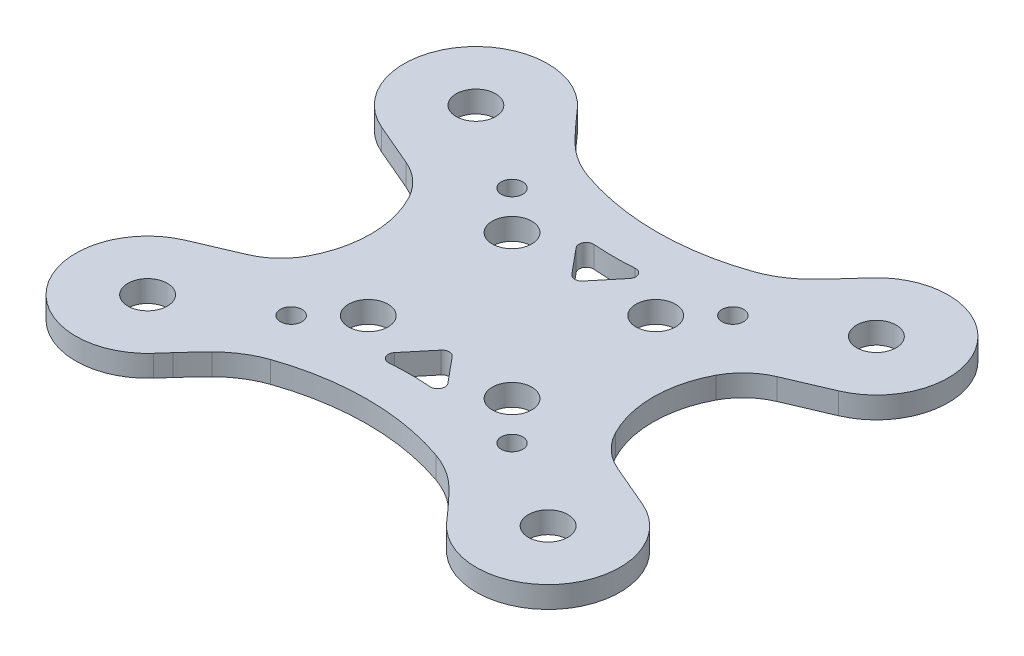
from build123d import *

# Parameters (mm, degrees)
SKETCH2_R           = 1.5
SKETCH2_R_2         = 2.75
BOSS_EXTRUDE1_DEPTH = 3


with BuildPart() as part:
    # Sketch2 → Boss-Extrude1 (new body)
    with BuildSketch(Plane(origin=(0, 0, 0), x_dir=(1, 0, 0), z_dir=(0, 1, 0))):
        with BuildLine():
            Line((-20.402989885, -29.497935256), (-19.112268572, -28.051458372))
            ThreePointArc((-19.112268572, -28.051458372), (-17.810696545, -26.629075982), (-16.473919979, -25.239727278))
            ThreePointArc((-16.473919979, -25.239727278), (-14.160863056, -23.377992793), (-11.485697638, -22.089669229))
            ThreePointArc((-11.485697638, -22.089669229), (0, -20.15141071), (11.485697638, -22.089669229))
            ThreePointArc((11.485697638, -22.089669229), (14.160863056, -23.377992793), (16.473919979, -25.239727278))
            ThreePointArc((16.473919979, -25.239727278), (17.810696545, -26.629075982), (19.112268572, -28.051458372))
            Line((19.112268572, -28.051458372), (20.402989885, -29.497935256))
            ThreePointArc((20.402989885, -29.497935256), (35.984508278, -28.676365345), (31.796806607, -13.645668513))
            Line((31.796806607, -13.645668513), (25.794436634, -11.078432427))
            ThreePointArc((25.794436634, -11.078432427), (23.235962273, -9.423067761), (21.376539879, -7.008824278))
            ThreePointArc((21.376539879, -7.008824278), (19.638379202, 0), (21.376539879, 7.008824278))
            ThreePointArc((21.376539879, 7.008824278), (23.235962273, 9.423067761), (25.794436634, 11.078432427))
            Line((25.794436634, 11.078432427), (31.796806607, 13.645668513))
            ThreePointArc((31.796806607, 13.645668513), (35.984508278, 28.676365345), (20.402989885, 29.497935256))
            Line((20.402989885, 29.497935256), (19.112268572, 28.051458372))
            ThreePointArc((19.112268572, 28.051458372), (17.810696545, 26.629075982), (16.473919979, 25.239727278))
            ThreePointArc((16.473919979, 25.239727278), (14.160863056, 23.377992793), (11.485697638, 22.089669229))
            ThreePointArc((11.485697638, 22.089669229), (0, 20.15141071), (-11.485697638, 22.089669229))
            ThreePointArc((-11.485697638, 22.089669229), (-14.160863056, 23.377992793), (-16.473919979, 25.239727278))
            ThreePointArc((-16.473919979, 25.239727278), (-17.810696545, 26.629075982), (-19.112268572, 28.051458372))
            Line((-19.112268572, 28.051458372), (-20.402989885, 29.497935256))
            ThreePointArc((-20.402989885, 29.497935256), (-35.984508278, 28.676365345), (-31.796806607, 13.645668513))
            Line((-31.796806607, 13.645668513), (-25.794436634, 11.078432427))
            ThreePointArc((-25.794436634, 11.078432427), (-23.235962273, 9.423067761), (-21.376539879, 7.008824278))
            ThreePointArc((-21.376539879, 7.008824278), (-19.638379202, 0), (-21.376539879, -7.008824278))
            ThreePointArc((-21.376539879, -7.008824278), (-23.235962273, -9.423067761), (-25.794436634, -11.078432427))
            Line((-25.794436634, -11.078432427), (-31.796806607, -13.645668513))
            ThreePointArc((-31.796806607, -13.645668513), (-35.984508278, -28.676365345), (-20.402989885, -29.497935256))
        make_face()
        with Locations((15.365, -15.365)):
            Circle(SKETCH2_R, mode=Mode.SUBTRACT)
        with Locations((27.864354565, 22.840004863)):
            Circle(SKETCH2_R_2, mode=Mode.SUBTRACT)
        with Locations((-15.365, 15.365)):
            Circle(SKETCH2_R, mode=Mode.SUBTRACT)
        with Locations((15.365, 15.365)):
            Circle(SKETCH2_R, mode=Mode.SUBTRACT)
        with Locations((-15.365, -15.365)):
            Circle(SKETCH2_R, mode=Mode.SUBTRACT)
        with Locations((27.864354565, -22.840004863)):
            Circle(SKETCH2_R_2, mode=Mode.SUBTRACT)
        with Locations((10.000016395, -10.000011804)):
            Circle(SKETCH2_R_2, mode=Mode.SUBTRACT)
        with Locations((-27.864354565, 22.840004863)):
            Circle(SKETCH2_R_2, mode=Mode.SUBTRACT)
        with Locations((-27.864354565, -22.840004863)):
            Circle(SKETCH2_R_2, mode=Mode.SUBTRACT)
        with Locations((-10.000016395, -10.000011804)):
            Circle(SKETCH2_R_2, mode=Mode.SUBTRACT)
        with Locations((-10.000016395, 10.000011804)):
            Circle(SKETCH2_R_2, mode=Mode.SUBTRACT)
        with Locations((10.000016395, 10.000011804)):
            Circle(SKETCH2_R_2, mode=Mode.SUBTRACT)
        with BuildLine():
            Line((3.71054333, -12.635244665), (0.769622246, -9.090373716))
            ThreePointArc((0.769622246, -9.090373716), (0, -8.728873205), (-0.769622246, -9.090373716))
            Line((-0.769622246, -9.090373716), (-3.71054333, -12.635244665))
            ThreePointArc((-3.71054333, -12.635244665), (-3.829359507, -13.73273998), (-2.865512851, -14.2708969))
            ThreePointArc((-2.865512851, -14.2708969), (0, -14.16270124), (2.865512851, -14.2708969))
            ThreePointArc((2.865512851, -14.2708969), (3.829359508, -13.73273998), (3.71054333, -12.635244665))
        make_face(mode=Mode.SUBTRACT)
        with BuildLine():
            Line((-3.71054333, 12.635244665), (-0.769622246, 9.090373716))
            ThreePointArc((-0.769622246, 9.090373716), (0, 8.728873205), (0.769622246, 9.090373716))
            Line((0.769622246, 9.090373716), (3.71054333, 12.635244665))
            ThreePointArc((3.71054333, 12.635244665), (3.829359507, 13.73273998), (2.865512851, 14.2708969))
            ThreePointArc((2.865512851, 14.2708969), (0, 14.16270124), (-2.865512851, 14.2708969))
            ThreePointArc((-2.865512851, 14.2708969), (-3.829359508, 13.73273998), (-3.71054333, 12.635244665))
        make_face(mode=Mode.SUBTRACT)
    extrude(amount=BOSS_EXTRUDE1_DEPTH)


solid = part.part
